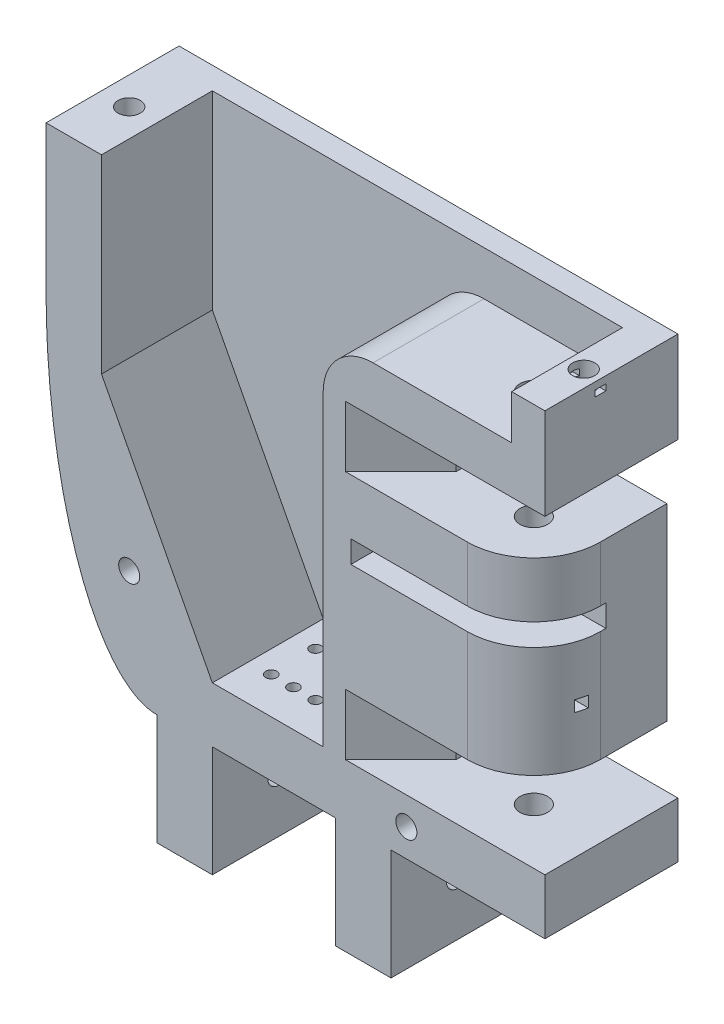
from build123d import *

# Parameters (mm, degrees)
SKETCH2_W                      = 114.3
SKETCH2_H                      = 142.875
BOSS_EXTRUDE2_DEPTH            = 30.48
FILLET1_SIZE                   = 25.4
FILLET1_SIZE_2                 = 71.501
BOSS_EXTRUDE3_DEPTH            = 11.43
CUT_EXTRUDE2_DEPTH             = 25.4
FILLET2_R                      = 1.27
SKETCH7_W                      = 27.94
SKETCH7_H                      = 30.48
CUT_EXTRUDE4_DEPTH             = 12.7
BOSS_EXTRUDE4_DEPTH            = 11.43
CUT_EXTRUDE6_DEPTH             = 25.4
CUT_EXTRUDE7_DEPTH             = 171.262283535
CUT_EXTRUDE7_DEPTH_BACK        = 171.262283535
SKETCH11_R                     = 3.175
CUT_EXTRUDE8_REACH             = 185.225
SKETCH12_R                     = 3.175
CUT_EXTRUDE8_DIRECTION_2_DEPTH = 184.224735996
CHAMFER1_SIZE2                 = 12.7
CHAMFER1_SIZE                  = 2.54
SKETCH13_W                     = 7.62
SKETCH13_H                     = 5.08
CUT_EXTRUDE9_DEPTH             = 25.4
FILLET4_R                      = 1.27
CUT_EXTRUDE10_DEPTH            = 195.431359314
CHAMFER2_SIZE                  = 12.7
CUT_EXTRUDE11_REACH            = 196.431
SKETCH15_R                     = 3.175
BOSS_EXTRUDE5_DEPTH            = 1.27
CHAMFER3_SIZE                  = 1.27
BOSS_EXTRUDE6_DEPTH            = 1.27
CHAMFER4_SIZE                  = 1.27
FILLET5_R                      = 15.24
CUT_EXTRUDE12_DEPTH            = 16.51
SKETCH20_W                     = 2.54
SKETCH20_H                     = 2.54
CUT_EXTRUDE13_DEPTH            = 171.777226453
FILLET6_R                      = 1.27
CUT_EXTRUDE14_DEPTH            = 1.27
CUT_EXTRUDE14_DEPTH_BACK       = 1.27
SKETCH21_W                     = 5.08
SKETCH21_H                     = 33.02
SKETCH21_H_2                   = 10.040791179
SKETCH21_H_3                   = 10.09120709
SKETCH21_W_2                   = 7.62
SKETCH21_H_4                   = 1.402013576
SKETCH21_W_3                   = 1.485233779
FILLET7_R                      = 11.43
SKETCH22_R                     = 1.27
CUT_EXTRUDE15_DEPTH            = 12.7
CUT_EXTRUDE16_DEPTH            = 196.440786647
CUT_EXTRUDE16_DEPTH_BACK       = 196.440786647
SKETCH23_R                     = 2.413
SKETCH24_W                     = 12.7
SKETCH24_H                     = 30.48
BOSS_EXTRUDE7_DEPTH            = 25.4
SKETCH25_R                     = 2.54
CUT_EXTRUDE17_DEPTH            = 178.14615249
CUT_EXTRUDE18_DEPTH            = 30.48
CUT_EXTRUDE18_DEPTH_BACK       = 25.4
SKETCH26_W                     = 134.610990208
SKETCH26_H                     = 60.509174752
SKETCH27_R                     = 2.54
CUT_EXTRUDE19_DEPTH            = 5.08


# Some blends are built 0.0001 mm under size
with BuildPart() as part:
    # Sketch2 → Boss-Extrude2 (new body)
    with BuildSketch(Plane.XY):
        with Locations((57.15, 71.4375)):
            Rectangle(SKETCH2_W, SKETCH2_H)
    extrude(amount=BOSS_EXTRUDE2_DEPTH)

    # Fillet1
    # an asymmetric fillet: 71.501, 25.4 mm, written as the material it takes off along each edge
    with BuildSketch(Plane(origin=(0, 0, -178.7525), x_dir=(1, 0, 0), z_dir=(0, 0, 1))) as fillet1_piece_1:
        with BuildLine():
            Bezier((FILLET1_SIZE, 0), (0, 0), (0, FILLET1_SIZE_2), weights=[1, 0.707106781, 1])
            Line((0, FILLET1_SIZE_2), (0, 0))
            Line((0, 0), (FILLET1_SIZE, 0))
        make_face()
    extrude(amount=387.985, mode=Mode.SUBTRACT)

    # Sketch3 → Boss-Extrude3 (add)
    with BuildSketch(Plane(origin=(0, 142.875, 0), x_dir=(1, 0, 0), z_dir=(0, 1, 0))):
        with BuildLine():
            Line((33.866582, -7.62), (33.866582, -27.94))
            ThreePointArc((33.866582, -27.94), (28.786582, -17.78), (33.866582, -7.62))
        make_face()
        with BuildLine():
            Line((49.106582, -7.62), (49.106582, -27.94))
            ThreePointArc((49.106582, -27.94), (54.186582, -17.78), (49.106582, -7.62))
        make_face()
    extrude(amount=BOSS_EXTRUDE3_DEPTH)

    # Sketch5 → Cut-Extrude2 (cut)
    with BuildSketch(Plane.XY.offset(30.48)):
        with BuildLine():
            Line((62.653333333, 142.875), (77.893333333, 142.875))
            ThreePointArc((77.893333333, 142.875), (70.273333333, 119.445231961), (62.653333333, 142.875))
        make_face()
        with BuildLine():
            Line((91.44, 143.032457663), (106.68, 143.032457663))
            ThreePointArc((106.68, 143.032457663), (99.06, 119.602689625), (91.44, 143.032457663))
        make_face()
    extrude(amount=-CUT_EXTRUDE2_DEPTH, mode=Mode.SUBTRACT)

    # Fillet2
    fillet2_edges = [part.edges().sort_by_distance(p)[0] for p in [
        (77.893333333, 142.875, 17.78),
        (62.653333333, 142.875, 17.78),
        (91.228104508, 142.875, 17.78),
    ]]
    fillet(fillet2_edges, radius=FILLET2_R)

    # Sketch7 → Cut-Extrude4 (cut)
    with BuildSketch(Plane(origin=(0, 142.875, 0), x_dir=(1, 0, 0), z_dir=(0, 1, 0))):
        with Locations((13.97, -15.24)):
            Rectangle(SKETCH7_W, SKETCH7_H)
    extrude(amount=-CUT_EXTRUDE4_DEPTH, mode=Mode.SUBTRACT)

    # Sketch8 → Boss-Extrude4 (add)
    with BuildSketch(Plane(origin=(0, 130.175, 0), x_dir=(1, 0, 0), z_dir=(0, 1, 0))):
        with BuildLine():
            Line((5.08, -7.62), (5.08, -27.94))
            ThreePointArc((5.08, -27.94), (0, -17.78), (5.08, -7.62))
        make_face()
        with BuildLine():
            Line((20.32, -7.62), (20.32, -27.94))
            ThreePointArc((20.32, -27.94), (25.4, -17.78), (20.32, -7.62))
        make_face()
    extrude(amount=BOSS_EXTRUDE4_DEPTH)

    # Sketch10 → Cut-Extrude6 (cut)
    with BuildSketch(Plane.XY.offset(30.48)):
        Polygon((63.5, 109.855), (12.7, 109.855), (12.7, 61.2775), (38.1, 12.7), (63.5, 12.7), (63.5, 94.615), (106.68, 94.615), (106.68, 109.855), align=None)
    extrude(amount=-CUT_EXTRUDE6_DEPTH, mode=Mode.SUBTRACT)

    # Sketch11 → Cut-Extrude7 (cut, two sides: drawn at the far end of the back side and taken through both)
    with BuildSketch(Plane.ZY.offset(-49.106582).offset(-CUT_EXTRUDE7_DEPTH_BACK)):
        with Locations((17.78, 149.225)):
            Circle(SKETCH11_R)
        with BuildLine():
            Line((22.044917923, 151.984868677), (27.94, 142.875))
            Line((27.94, 142.875), (27.94, 154.305))
            Line((27.94, 154.305), (17.78, 154.305))
            ThreePointArc((17.78, 154.305), (20.207577715, 153.687428312), (22.044917923, 151.984868677))
        make_face()
    extrude(amount=CUT_EXTRUDE7_DEPTH + CUT_EXTRUDE7_DEPTH_BACK, mode=Mode.SUBTRACT)

    # Cut-Extrude8: up to this face of the body (flat: up to its plane)
    cut_extrude8_end = Plane(part.part.faces().sort_by_distance((27.94, 136.525, 15.24))[0])
    # Sketch12 → Cut-Extrude8 (cut, up to the picked face)
    with BuildSketch(Plane.ZY.offset(-20.32), mode=Mode.PRIVATE) as cut_extrude8_sk1:
        with Locations((17.78, 136.525)):
            Circle(SKETCH12_R)
    cut_extrude8_tool1 = split(extrude(cut_extrude8_sk1.sketch, amount=-CUT_EXTRUDE8_REACH, mode=Mode.PRIVATE), bisect_by=cut_extrude8_end, keep=Keep.BOTH, mode=Mode.PRIVATE)
    # Sketch12 → Cut-Extrude8 (cut, up to the picked face)
    with BuildSketch(Plane.ZY.offset(-20.32), mode=Mode.PRIVATE) as cut_extrude8_sk2:
        with BuildLine():
            Line((22.044917923, 139.284868677), (27.94, 130.175))
            Line((27.94, 130.175), (27.94, 141.605))
            Line((27.94, 141.605), (17.78, 141.605))
            ThreePointArc((17.78, 141.605), (20.207577715, 140.987428312), (22.044917923, 139.284868677))
        make_face()
    cut_extrude8_tool2 = split(extrude(cut_extrude8_sk2.sketch, amount=-CUT_EXTRUDE8_REACH, mode=Mode.PRIVATE), bisect_by=cut_extrude8_end, keep=Keep.BOTH, mode=Mode.PRIVATE)
    add(cut_extrude8_tool1.solids().sort_by(Axis((20.32, 136.525, 17.78), (1, 0, 0)))[0], mode=Mode.SUBTRACT)
    add(cut_extrude8_tool2.solids().sort_by(Axis((20.32, 137.885407, 25.333291), (1, 0, 0)))[0], mode=Mode.SUBTRACT)

    # Sketch12 → Cut-Extrude8 direction 2 (cut)
    with BuildSketch(Plane.ZY.offset(-20.32)):
        with Locations((17.78, 136.525)):
            Circle(SKETCH12_R)
        with BuildLine():
            Line((22.044917923, 139.284868677), (27.94, 130.175))
            Line((27.94, 130.175), (27.94, 141.605))
            Line((27.94, 141.605), (17.78, 141.605))
            ThreePointArc((17.78, 141.605), (20.207577715, 140.987428312), (22.044917923, 139.284868677))
        make_face()
    extrude(amount=CUT_EXTRUDE8_DIRECTION_2_DEPTH, mode=Mode.SUBTRACT)

    # Chamfer1
    chamfer1_edges = [part.edges().sort_by_distance(p)[0] for p in [
        (27.94, 130.175, 15.24),
    ]]
    chamfer1_side = [part.faces().sort_by_distance(p)[0] for p in [
        (27.8892, 130.175, 15.24),
    ]]
    chamfer(chamfer1_edges, length=CHAMFER1_SIZE - 0.0001, length2=CHAMFER1_SIZE2 - 0.0001, reference=chamfer1_side[0])  # a hair under: the kernel refuses the full size

    # Sketch13 → Cut-Extrude9 (cut)
    with BuildSketch(Plane.XY.offset(30.48)):
        with Locations((110.49, 140.335)):
            Rectangle(SKETCH13_W, SKETCH13_H)
    extrude(amount=-CUT_EXTRUDE9_DEPTH, mode=Mode.SUBTRACT)

    # Fillet4
    fillet4_edges = [part.edges().sort_by_distance(p)[0] for p in [
        (110.907625096, 137.795, 17.78),
        (114.3, 137.795, 17.78),
    ]]
    fillet(fillet4_edges, radius=FILLET4_R)

    # Sketch14 → Cut-Extrude10 (cut, through all)
    with BuildSketch(Plane.XY.offset(30.48)):
        Polygon((114.3, 12.7), (81.28, 12.7), (81.28, 26.67), (111.76, 26.67), (111.76, 69.85), (81.28, 69.85), (81.28, 83.82), (114.3, 83.82), align=None)
    extrude(amount=-CUT_EXTRUDE10_DEPTH, mode=Mode.SUBTRACT)

    # Chamfer2
    chamfer2_edges = [part.edges().sort_by_distance(p)[0] for p in [
        (81.28, 76.835, 30.48),
        (81.28, 19.685, 30.48),
    ]]
    chamfer(chamfer2_edges, length=CHAMFER2_SIZE)

    # Cut-Extrude11: up to this face of the body (flat: up to its plane)
    cut_extrude11_end = Plane(part.part.faces().sort_by_distance((59.69, 109.855, 17.78))[0])
    # Sketch15 → Cut-Extrude11 (cut, up to the picked face)
    with BuildSketch(Plane.XZ, mode=Mode.PRIVATE) as cut_extrude11_sk1:
        with Locations(Location((99.06, 17.78, 0), (0, 0, 270))):
            Circle(SKETCH15_R)
    cut_extrude11_tool1 = split(extrude(cut_extrude11_sk1.sketch, amount=-CUT_EXTRUDE11_REACH, mode=Mode.PRIVATE), bisect_by=cut_extrude11_end, keep=Keep.BOTH, mode=Mode.PRIVATE)
    add(cut_extrude11_tool1.solids().sort_by(Axis((99.06, 0, 17.78), (0, 1, 0)))[0], mode=Mode.SUBTRACT)

    # Sketch16 → Boss-Extrude5 (add)
    with BuildSketch(Plane(origin=(0, 141.605, 0), x_dir=(1, 0, 0), z_dir=(0, 1, 0))):
        with BuildLine():
            Line((0.406992957, -14.590646171), (5.08, -14.605))
            Line((5.08, -14.605), (5.08, -7.62))
            ThreePointArc((5.08, -7.62), (2.151092977, -10.708185479), (0.406992957, -14.590646171))
        make_face()
        with BuildLine():
            Line((20.32, -14.605), (24.996722124, -14.605))
            ThreePointArc((24.996722124, -14.605), (23.253033275, -10.714344425), (20.32, -7.62))
            Line((20.32, -7.62), (20.32, -14.605))
        make_face()
    extrude(amount=BOSS_EXTRUDE5_DEPTH)

    # Chamfer3
    chamfer3_edges = [part.edges().sort_by_distance(p)[0] for p in [
        (22.658361062, 142.875, 14.605),
        (2.743496479, 142.875, 14.597823086),
    ]]
    chamfer(chamfer3_edges, length=CHAMFER3_SIZE - 0.0001)  # a hair under: the kernel refuses the full size

    # Sketch17 → Boss-Extrude6 (add)
    with BuildSketch(Plane(origin=(0, 154.305, 0), x_dir=(1, 0, 0), z_dir=(0, 1, 0))):
        with BuildLine():
            Line((29.150536334, -14.761394806), (33.866582, -14.761394806))
            Line((33.866582, -14.761394806), (33.866582, -7.62))
            ThreePointArc((33.866582, -7.62), (30.888902084, -10.781487273), (29.150536334, -14.761394806))
        make_face()
        with BuildLine():
            Line((49.106582, -14.761394806), (53.822627666, -14.761394806))
            ThreePointArc((53.822627666, -14.761394806), (52.084261916, -10.781487273), (49.106582, -7.62))
            Line((49.106582, -7.62), (49.106582, -14.761394806))
        make_face()
    extrude(amount=BOSS_EXTRUDE6_DEPTH)

    # Chamfer4
    chamfer4_edges = [part.edges().sort_by_distance(p)[0] for p in [
        (51.464604833, 155.575, 14.761394806),
        (31.508559167, 155.575, 14.761394806),
    ]]
    chamfer(chamfer4_edges, length=CHAMFER4_SIZE - 0.0001)  # a hair under: the kernel refuses the full size

    # Fillet5
    fillet5_edges = [part.edges().sort_by_distance(p)[0] for p in [
        (111.76, 48.26, 30.48),
    ]]
    fillet(fillet5_edges, radius=FILLET5_R)

    # Sketch19 → Cut-Extrude12 (cut)
    with BuildSketch(Plane.XY.offset(30.48)):
        Polygon((81.28, 52.07), (111.76, 52.07), (111.76, 57.15), (81.28, 57.15), (69.85, 57.15), (69.85, 52.07), align=None)
    extrude(amount=-CUT_EXTRUDE12_DEPTH, mode=Mode.SUBTRACT)

    # Sketch20 → Cut-Extrude13 (cut, through all)
    with BuildSketch(Plane.ZY.offset(-63.5)):
        with Locations((19.05, 39.37)):
            Rectangle(SKETCH20_W, SKETCH20_H)
    extrude(amount=-CUT_EXTRUDE13_DEPTH, mode=Mode.SUBTRACT)

    # Fillet6
    fillet6_edges = [part.edges().sort_by_distance(p)[0] for p in [
        (63.5, 38.1, 19.05),
    ]]
    fillet(fillet6_edges, radius=FILLET6_R)

    # Sketch21 → Cut-Extrude14 (cut, two sides: drawn at the far end of the back side and taken through both)
    with BuildSketch(Plane.XY.offset(17.78).offset(-CUT_EXTRUDE14_DEPTH_BACK)):
        Polygon((12.7, 109.855), (10.485930724, 130.175), (15.565930724, 130.175), (17.78, 109.855), align=None)
        Polygon((55.429725371, 142.875), (50.86041281, 121.653709764), (50.86041281, 109.855), (52.449738918, 109.855), (52.449738918, 121.653709764), (57.019051479, 142.875), align=None)
        with Locations((41.486582, 126.365)):
            Rectangle(SKETCH21_W, SKETCH21_H)
        with Locations((69.426582, 114.87539559)):
            Rectangle(SKETCH21_W, SKETCH21_H_2)
        with Locations((98.636582, 114.900603545)):
            Rectangle(SKETCH21_W, SKETCH21_H_3)
        with Locations((110.49, 102.445426643)):
            Rectangle(SKETCH21_W_2, SKETCH21_H_4)
        with Locations((84.636338767, 126.365)):
            Rectangle(SKETCH21_W_3, SKETCH21_H)
    extrude(amount=CUT_EXTRUDE14_DEPTH + CUT_EXTRUDE14_DEPTH_BACK, mode=Mode.SUBTRACT)

    # Fillet7
    fillet7_edges = [part.edges().sort_by_distance(p)[0] for p in [
        (63.5, 94.615, 17.78),
    ]]
    fillet(fillet7_edges, radius=FILLET7_R)

    # Sketch22 → Cut-Extrude15 (cut)
    with BuildSketch(Plane(origin=(0, 12.7, 0), x_dir=(1, 0, 0), z_dir=(0, 1, 0))):
        with Locations(Location((43.18, -11.908276952, 0), (0, 0, 180))):
            Circle(SKETCH22_R)
        with Locations(Location((48.26, -11.908276952, 0), (0, 0, 180))):
            Circle(SKETCH22_R)
        with Locations(Location((53.34, -11.908276952, 0), (0, 0, 180))):
            Circle(SKETCH22_R)
        with Locations(Location((58.42, -11.908276952, 0), (0, 0, 180))):
            Circle(SKETCH22_R)
        with Locations(Location((43.18, -22.068276952, 0), (0, 0, 180))):
            Circle(SKETCH22_R)
        with Locations(Location((48.26, -22.068276952, 0), (0, 0, 180))):
            Circle(SKETCH22_R)
        with Locations(Location((53.34, -22.068276952, 0), (0, 0, 180))):
            Circle(SKETCH22_R)
        with Locations(Location((58.42, -22.068276952, 0), (0, 0, 180))):
            Circle(SKETCH22_R)
    extrude(amount=-CUT_EXTRUDE15_DEPTH, mode=Mode.SUBTRACT)

    # Sketch23 → Cut-Extrude16 (cut, two sides: drawn at the far end of the back side and taken through both)
    with BuildSketch(Plane(origin=(0, 0, 0), x_dir=(-1, 0, 0), z_dir=(0, 0, -1)).offset(-CUT_EXTRUDE16_DEPTH_BACK)):
        with Locations((-25.4, 120.65)):
            Circle(SKETCH23_R)
        with Locations((-19.05, 25.4)):
            Circle(SKETCH23_R)
        with Locations((-82.55, 6.35)):
            Circle(SKETCH23_R)
    extrude(amount=CUT_EXTRUDE16_DEPTH + CUT_EXTRUDE16_DEPTH_BACK, mode=Mode.SUBTRACT)

    # Sketch24 → Boss-Extrude7 (add)
    with BuildSketch(Plane.XZ):
        with Locations((31.75, 15.24)):
            Rectangle(SKETCH24_W, SKETCH24_H)
        with Locations((72.695229231, 15.24)):
            Rectangle(SKETCH24_W, SKETCH24_H)
    extrude(amount=BOSS_EXTRUDE7_DEPTH)

    # Sketch25 → Cut-Extrude17 (cut, through all)
    with BuildSketch(Plane(origin=(79.045229231, 0, 0), x_dir=(0, 0, -1), z_dir=(1, 0, 0))):
        with Locations((-15.24, -12.7)):
            Circle(SKETCH25_R)
    extrude(amount=-CUT_EXTRUDE17_DEPTH, mode=Mode.SUBTRACT)

    # Sketch26 → Cut-Extrude18 (cut, two sides: drawn at the far end of the back side and taken through both)
    with BuildSketch(Plane(origin=(0, 130.175, 0), x_dir=(1, 0, 0), z_dir=(0, 1, 0)).offset(-CUT_EXTRUDE18_DEPTH_BACK)):
        with Locations((56.532775219, -11.951457894)):
            Rectangle(SKETCH26_W, SKETCH26_H)
    extrude(amount=CUT_EXTRUDE18_DEPTH + CUT_EXTRUDE18_DEPTH_BACK, mode=Mode.SUBTRACT)

    # Sketch27 → Cut-Extrude19 (cut)
    with BuildSketch(Plane(origin=(0, 104.775, 0), x_dir=(1, 0, 0), z_dir=(0, 1, 0))):
        with Locations(Location((6.35, -17.78, 0), (0, 0, 270))):
            Circle(SKETCH27_R)
        with Locations(Location((110.49, -17.78, 0), (0, 0, 270))):
            Circle(SKETCH27_R)
    extrude(amount=-CUT_EXTRUDE19_DEPTH, mode=Mode.SUBTRACT)


solid = part.part
